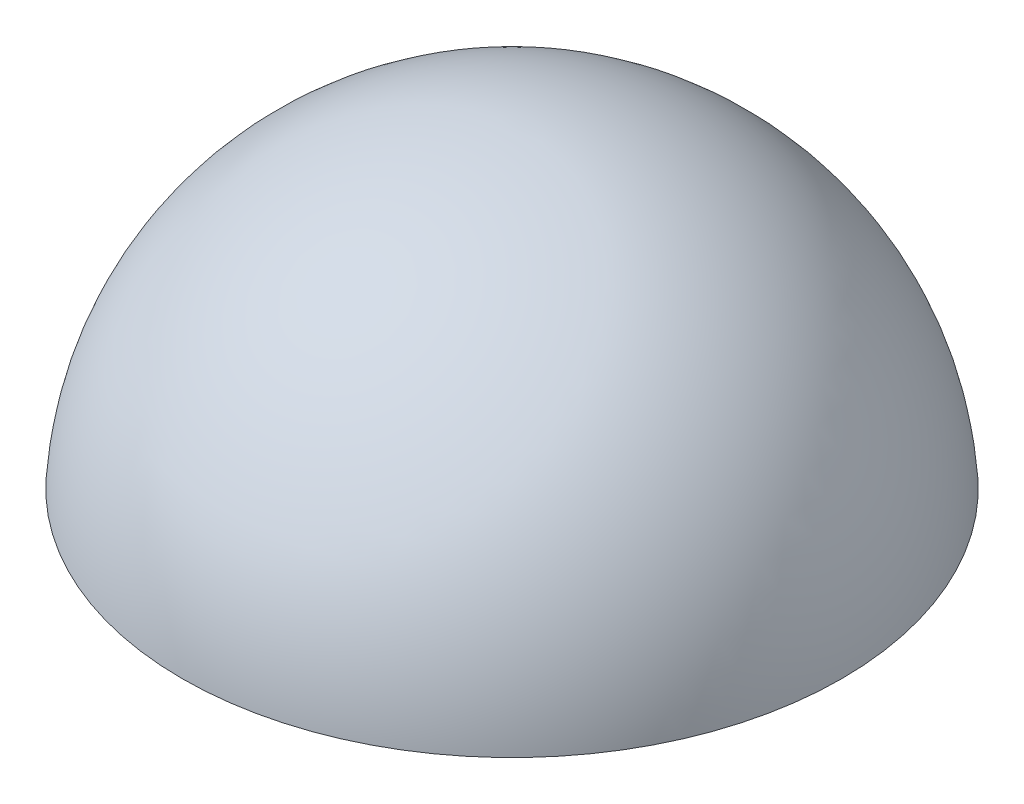
from build123d import *

# Parameters (mm, degrees)
SKETCH2_R          = 7.5
CUT_EXTRUDE1_DEPTH = 18
THREAD1_PITCH      = 2
THREAD1_FROM       = 2


with BuildPart() as part:
    # Sketch1 → Revolve7 (revolve)
    with BuildSketch(Plane.XY, mode=Mode.PRIVATE) as revolve7_sk:
        with BuildLine():
            Line((-29.933259094, 2), (0, 2))
            Line((0, 2), (0, 30))
            ThreePointArc((0, 30), (-20.493901532, 21.9089023), (-29.933259094, 2))
        make_face()
    revolve(revolve7_sk.sketch.rotate(Axis((0, 44.239334642, 0), (0, -1, 0)), 180), axis=Axis((0, 44.239334642, 0), (0, -1, 0)))

    # Sketch2 → Cut-Extrude1 (cut)
    with BuildSketch(Plane.XZ.offset(-2)):
        with Locations(Location((0, 0, 0), (0, 0, 270))):
            Circle(SKETCH2_R)
    extrude(amount=-CUT_EXTRUDE1_DEPTH, mode=Mode.SUBTRACT)

    # Thread1: arcs per turn and ends read off the stored shape
    # Thread1: the profile of Thread Profile1 profile screwed along a right-hand helix through 10 turns, 10 arcs to a turn; built about Z, then put on its axis
    thread1_z = Axis((0, 0, 0), (0, 0, 1))
    thread1_corners = [(7.5003, 2e-09, -0.000173205), (6.41746825, 2e-09, 0.624999997), (6.41746825, 2e-09, 0.874999997), (7.5003, 2e-09, 1.5001732)]
    with BuildLine(mode=Mode.PRIVATE) as thread1_profile:
        Line(thread1_corners[0], thread1_corners[1])
        Line(thread1_corners[1], thread1_corners[2])
        Line(thread1_corners[2], thread1_corners[3])
        Line(thread1_corners[3], thread1_corners[0])
    thread1_cap = Face(thread1_profile.wire())
    thread1_turn_angles = [0, 18, 36, 54, 72, 90, 108, 126, 144, 162, 180, 198, 216, 234, 252, 270, 288, 306, 324, 342, 360]
    thread1_turn_weights = [1, 0.9510565162951535, 1, 0.9510565162951535, 1, 0.9510565162951535, 1, 0.9510565162951535, 1, 0.9510565162951535, 1, 0.9510565162951535, 1, 0.9510565162951535, 1, 0.9510565162951535, 1, 0.9510565162951535, 1, 0.9510565162951535, 1]
    thread1_turn_rails = [Edge.make_bspline([Vector(p[0], p[1], 0).rotate(thread1_z, thread1_turn_angles[k]) / thread1_turn_weights[k] + Vector(0, 0, p[2] + THREAD1_PITCH * thread1_turn_angles[k] / 360) for k in range(21)], [0, 0, 0, 1, 1, 2, 2, 3, 3, 4, 4, 5, 5, 6, 6, 7, 7, 8, 8, 9, 9, 10, 10, 10], 2, thread1_turn_weights) for p in thread1_corners]
    thread1_turn_sides = [Face.make_surface_from_curves(thread1_turn_rails[p[0]], thread1_turn_rails[p[1]]) for p in [(0, 1), (1, 2), (2, 3), (3, 0)]]
    thread1 = Plane(origin=(0, 0, 0), x_dir=(0.998629535, 0, -0.052335956), z_dir=(0, 1, 0)) * split(Solid(Shell([*[p.moved(Location((0, 0, THREAD1_PITCH * i))) for i in range(10) for p in thread1_turn_sides], thread1_cap, thread1_cap.rotate(thread1_z, 3600).moved(Location((0, 0, THREAD1_PITCH * 3600 / 360)))])), bisect_by=Plane.XY.offset(THREAD1_FROM), keep=Keep.TOP, mode=Mode.PRIVATE)
    add(thread1)


solid = part.part
